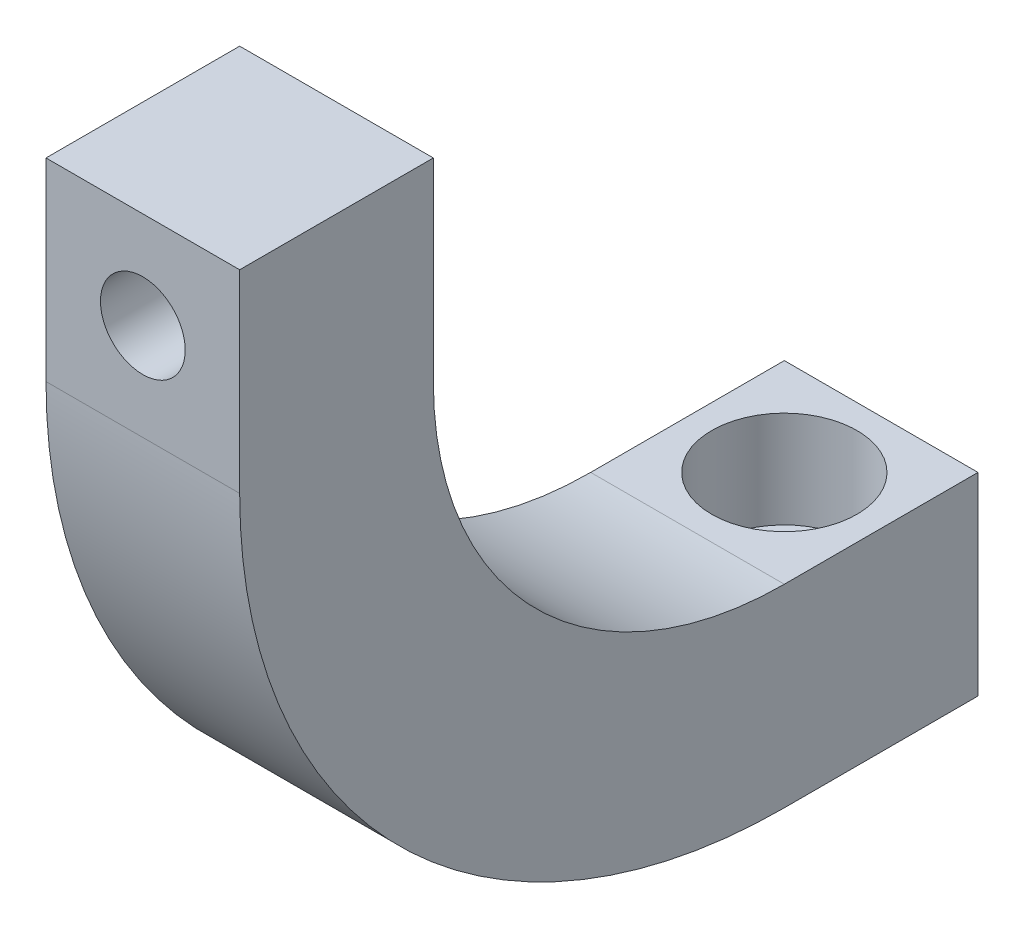
from build123d import *

# Parameters (mm, degrees)
BOSS_EXTRUDE1_DEPTH      = 4
BOSS_EXTRUDE1_DEPTH_BACK = 4
SKETCH7_R                = 1.75
CUT_EXTRUDE1_DEPTH       = 38.68952109
SKETCH8_R                = 1.75
CUT_EXTRUDE2_DEPTH       = 38.68952109
SKETCH9_R                = 3
CUT_EXTRUDE4_DEPTH       = 4
SKETCH10_R               = 3
CUT_EXTRUDE5_DEPTH       = 4


with BuildPart() as part:
    # Sketch5 → Boss-Extrude1 (new, two sides: drawn at the far end of the back side and taken through both)
    with BuildSketch(Plane(origin=(0, 0, 0), x_dir=(0, 0, -1), z_dir=(1, 0, 0)).offset(-BOSS_EXTRUDE1_DEPTH_BACK)):
        with BuildLine():
            Line((-18.5, 4), (-18.5, 0))
            Line((-18.5, 0), (-18.5, -4))
            ThreePointArc((-18.5, -4), (-14.253048327, -14.253048327), (-4, -18.5))
            Line((-4, -18.5), (0, -18.5))
            Line((0, -18.5), (4, -18.5))
            Line((4, -18.5), (4, -26.5))
            Line((4, -26.5), (-4, -26.5))
            ThreePointArc((-4, -26.5), (-19.909902577, -19.909902577), (-26.5, -4))
            Line((-26.5, -4), (-26.5, 4))
            Line((-26.5, 4), (-18.5, 4))
        make_face()
    extrude(amount=BOSS_EXTRUDE1_DEPTH + BOSS_EXTRUDE1_DEPTH_BACK)

    # Sketch7 → Cut-Extrude1 (cut, through all)
    with BuildSketch(Plane.XY):
        Circle(SKETCH7_R)
    extrude(amount=CUT_EXTRUDE1_DEPTH, mode=Mode.SUBTRACT)

    # Sketch8 → Cut-Extrude2 (cut, through all)
    with BuildSketch(Plane(origin=(0, 0, 0), x_dir=(1, 0, 0), z_dir=(0, 1, 0))):
        Circle(SKETCH8_R)
    extrude(amount=-CUT_EXTRUDE2_DEPTH, mode=Mode.SUBTRACT)

    # Sketch9 → Cut-Extrude4 (cut)
    with BuildSketch(Plane(origin=(0, -18.5, 0), x_dir=(1, 0, 0), z_dir=(0, 1, 0))):
        Circle(SKETCH9_R)
    extrude(amount=-CUT_EXTRUDE4_DEPTH, mode=Mode.SUBTRACT)

    # Sketch10 → Cut-Extrude5 (cut)
    with BuildSketch(Plane(origin=(0, 0, 18.5), x_dir=(-1, 0, 0), z_dir=(0, 0, -1))):
        Circle(SKETCH10_R)
    extrude(amount=-CUT_EXTRUDE5_DEPTH, mode=Mode.SUBTRACT)


solid = part.part
